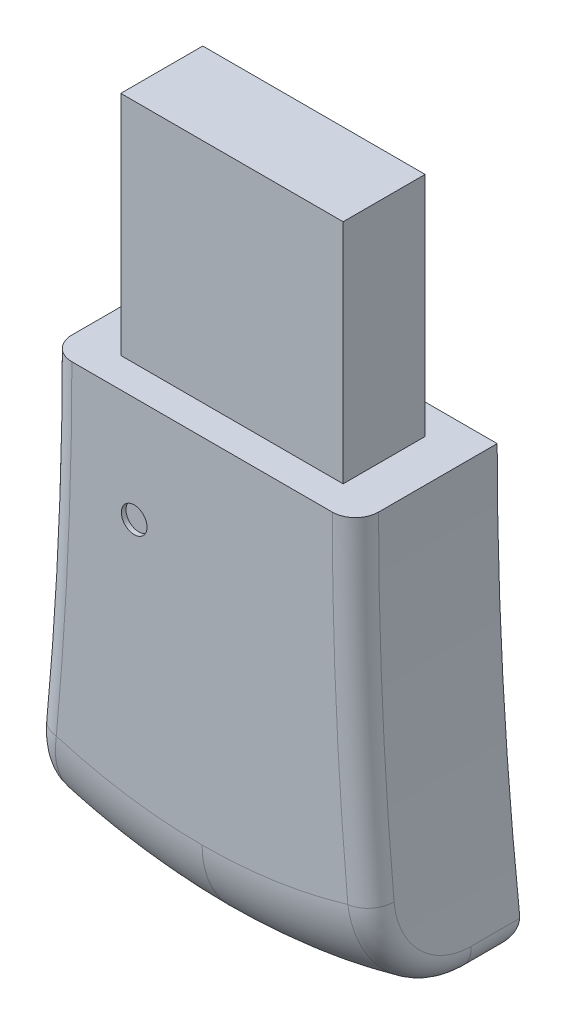
from build123d import *

# Parameters (mm, degrees)
SKETCH1_W           = 12.192
SKETCH1_H           = 4.4958
BOSS_EXTRUDE1_DEPTH = 12.446
BOSS_EXTRUDE2_DEPTH = 3.8862
FILLET1_R           = 5.08
FILLET2_R           = 1.27
SKETCH3_R           = 0.705537126
CUT_EXTRUDE1_DEPTH  = 0.254


# Read off the part's stored shape, not the designer's step: Mirror1
with BuildPart() as part:
    # Sketch1 → Boss-Extrude1 (new body)
    with BuildSketch(Plane(origin=(0, 0, 0), x_dir=(1, 0, 0), z_dir=(0, 1, 0))):
        Rectangle(SKETCH1_W, SKETCH1_H)
    extrude(amount=BOSS_EXTRUDE1_DEPTH)

    # Sketch2 → Boss-Extrude2 (add, symmetric)
    with BuildSketch(Plane.XY):
        with BuildLine():
            Line((0, 0), (-8.4074, 0))
            ThreePointArc((-8.4074, 0), (-8.750605066, -11.506432361), (-9.779, -22.971953685))
            ThreePointArc((-9.779, -22.971953685), (-4.945799179, -24.086008668), (0, -24.4602))
            Line((0, -24.4602), (0, 0))
        make_face()
    extrude(amount=BOSS_EXTRUDE2_DEPTH, both=True)

    # Fillet1
    fillet1_edges = [part.edges().sort_by_distance(p)[0] for p in [
        (-4.945799179, -24.086008668, 3.8862),
    ]]
    fillet(fillet1_edges, radius=FILLET1_R)

    # Fillet2
    fillet2_edges = [part.edges().sort_by_distance(p)[0] for p in [
        (-4.945799179, -24.086008668, -3.8862),
        (-8.61315874, -8.910874841, 3.8862),
        (-9.779, -22.971953685, -2.54),
        (-9.601797377, -21.441669836, 2.422651407),
    ]]
    fillet(fillet2_edges, radius=FILLET2_R)

    # Mirror1: part across plane


with BuildPart() as part_1:
    add(part.part)
    add(part.part.mirror(Plane(origin=(0, 0, 0), x_dir=(0, 0, 1), z_dir=(1, 0, 0))))

    # Sketch3 → Cut-Extrude1 (cut)
    with BuildSketch(Plane.XY.offset(3.8862)):
        with Locations((-3.72090503, -5.794071086)):
            Circle(SKETCH3_R)
    extrude(amount=-CUT_EXTRUDE1_DEPTH, mode=Mode.SUBTRACT)


solid = part_1.part
